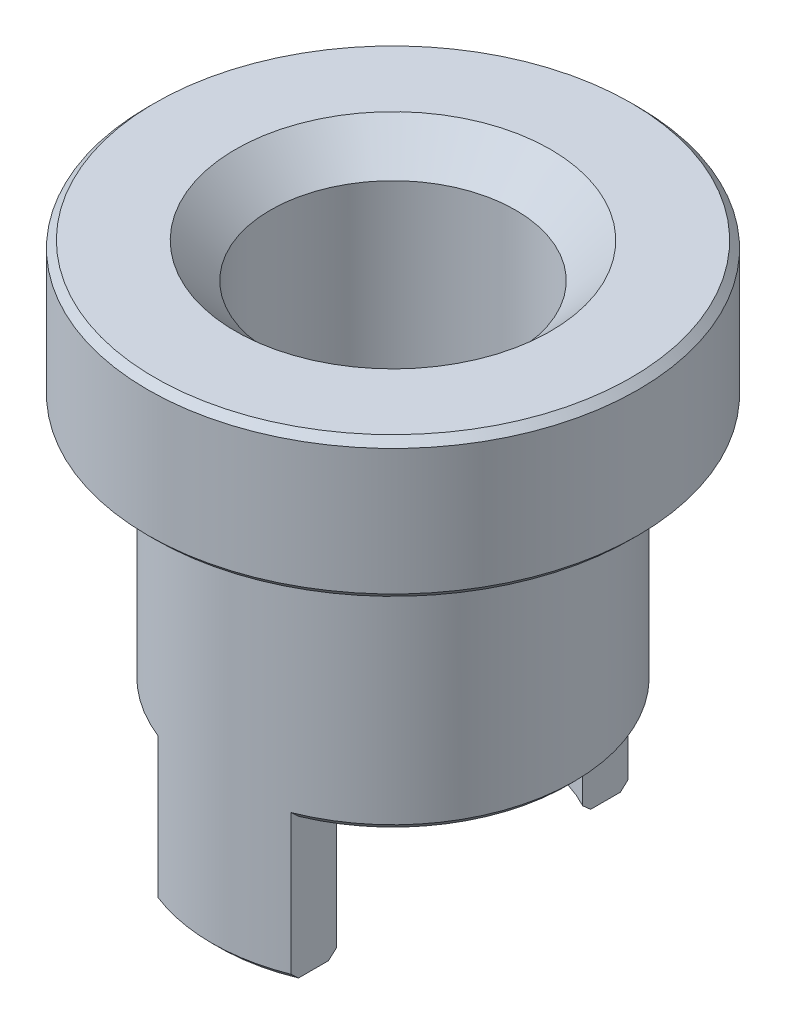
from build123d import *

# Parameters (mm, degrees)
CUT_EXTRUDE_1_DEPTH      = 18.972200756
CUT_EXTRUDE_1_DEPTH_BACK = 18.972200756
SKETCH_2_W               = 3.275
SKETCH_2_H               = 4
SKETCH_3_R               = 4
CUT_EXTRUDE_2_DEPTH      = 4
CHAMFER_1_SIZE           = 1
CHAMFER_2_SIZE           = 0.2


with BuildPart() as part:
    # Эскиз1 → Повернуть1 (revolve)
    with BuildSketch(Plane(origin=(0, 0, 0), x_dir=(0, 0, -1), z_dir=(1, 0, 0)), mode=Mode.PRIVATE) as revolve_1_sk:
        Polygon((3.5, 15), (3.5, 0), (5.175, 0), (5.175, 11), (7, 11), (7, 15), align=None)
    revolve(revolve_1_sk.sketch.rotate(Axis((0, 26.762195122, 0), (0, -1, 0)), 180), axis=Axis((0, 26.762195122, 0), (0, -1, 0)))

    # Эскиз2 → Вырез-Вытянуть1 (cut, two sides: drawn at the far end of the back side and taken through both)
    with BuildSketch(Plane.XY.offset(-CUT_EXTRUDE_1_DEPTH_BACK)):
        with Locations((3.5375, 2)):
            Rectangle(SKETCH_2_W, SKETCH_2_H)
        with Locations((-3.5375, 2)):
            Rectangle(SKETCH_2_W, SKETCH_2_H)
    extrude(amount=CUT_EXTRUDE_1_DEPTH + CUT_EXTRUDE_1_DEPTH_BACK, mode=Mode.SUBTRACT)

    # Эскиз3 → Вырез-Вытянуть2 (cut)
    with BuildSketch(Plane.XZ.offset(-4)):
        Circle(SKETCH_3_R)
    extrude(amount=CUT_EXTRUDE_2_DEPTH, mode=Mode.SUBTRACT)

    # Фаска1
    # the kernel refuses this chamfer: 1 mm, written as the material it takes off along each edge
    with BuildSketch(Plane(origin=(0, 4, 0), x_dir=(0, 0, 1), z_dir=(1, 0, 0))) as chamfer_1_piece_1_section:
        Polygon((3.5, -CHAMFER_1_SIZE), (3.5 + CHAMFER_1_SIZE, 0), (3.5, 0), align=None)
    chamfer_1_piece_1 = revolve(axis=Axis((0, 4, 0), (0, -1, 0)), mode=Mode.PRIVATE)
    chamfer_1_piece_1 = chamfer_1_piece_1 & Plane(origin=(0, 4.334033243, 0), x_dir=(1, 0, 0), z_dir=(0, 1, 0)) * Cylinder(4, 19, mode=Mode.PRIVATE)
    add(chamfer_1_piece_1, mode=Mode.SUBTRACT)
    with BuildSketch(Plane(origin=(0, 4, 0), x_dir=(0, 0, 1), z_dir=(1, 0, 0))) as chamfer_1_piece_2_section:
        Polygon((3.5, -CHAMFER_1_SIZE), (3.5 + CHAMFER_1_SIZE, 0), (3.5, 0), align=None)
    chamfer_1_piece_2 = revolve(axis=Axis((0, 4, 0), (0, -1, 0)), mode=Mode.PRIVATE)
    chamfer_1_piece_2 = split(chamfer_1_piece_2, bisect_by=Plane(origin=(-1.9, 4.24260685, 0), z_dir=(-1, 0, 0)), keep=Keep.TOP, mode=Mode.PRIVATE)
    add(chamfer_1_piece_2, mode=Mode.SUBTRACT)
    with BuildSketch(Plane(origin=(0, 4, 0), x_dir=(0, 0, 1), z_dir=(1, 0, 0))) as chamfer_1_piece_3_section:
        Polygon((3.5, -CHAMFER_1_SIZE), (3.5 + CHAMFER_1_SIZE, 0), (3.5, 0), align=None)
    chamfer_1_piece_3 = revolve(axis=Axis((0, 4, 0), (0, -1, 0)), mode=Mode.PRIVATE)
    chamfer_1_piece_3 = split(chamfer_1_piece_3, bisect_by=Plane(origin=(1.9, 4.24260685, 0), z_dir=(1, 0, 0)), keep=Keep.TOP, mode=Mode.PRIVATE)
    add(chamfer_1_piece_3, mode=Mode.SUBTRACT)
    with BuildSketch(Plane(origin=(0, 15, 0), x_dir=(0, 0, 1), z_dir=(1, 0, 0))) as chamfer_1_piece_4:
        Polygon((3.5, CHAMFER_1_SIZE), (3.5 + CHAMFER_1_SIZE, 0), (3.5, 0), align=None)
    revolve(axis=Axis((0, 15, 0), (0, -1, 0)), mode=Mode.SUBTRACT)

    # Фаска2
    chamfer_2_edges = [part.edges().sort_by_distance(p)[0] for p in [
        (0, 0, -5.175),
        (5.175, 4, 0),
        (0.967033992, 0, 5.083844043),
        (-5.175, 4, 0),
        (0, 15, -7),
        (0, 11, -7),
        (0, 11, -5.175),
        (0, 0, -4),
        (0, 0, 4),
    ]]
    chamfer(chamfer_2_edges, length=CHAMFER_2_SIZE)


solid = part.part
